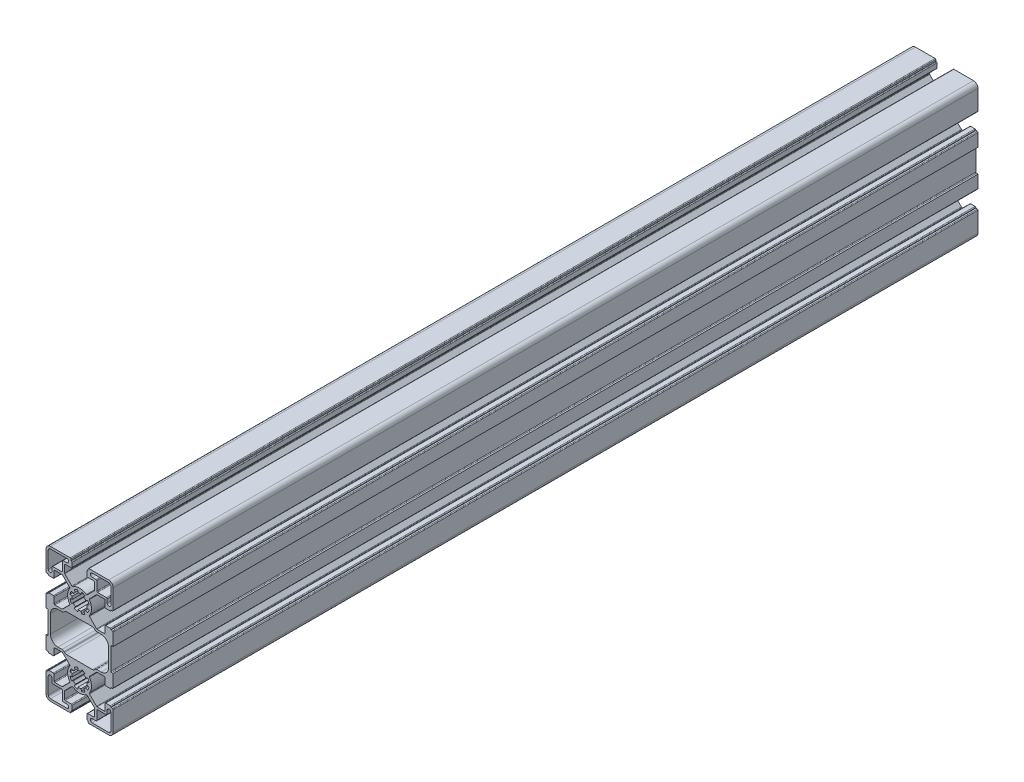
from build123d import *

# Parameters (mm, degrees)
SKETCH3_R            = 5
BOSS_EXTRUDE1_DEPTH  = 152.4
FILLET1_R            = 0.5
CUT_EXTRUDE1_DEPTH   = 309.92440823
FILLET1_OF_MIRROR1_R = 0.5
BOSS_EXTRUDE2_DEPTH  = 275.1


with BuildPart() as part:
    # Sketch3 → Boss-Extrude1 (new, symmetric)
    with BuildSketch(Plane.XY):
        with BuildLine():
            Line((-5.8, 45), (-5.8, 43.5))
            Line((-5.8, 43.5), (-5, 43.5))
            Line((-5, 43.5), (-5, 39.525))
            Line((-5, 39.525), (-10.05, 39.525))
            Line((-10.05, 39.525), (-10.05, 34.05))
            Line((-10.05, 34.05), (-4.856915373, 28.856915373))
            ThreePointArc((-4.856915373, 28.856915373), (0, 30.5), (4.856915373, 28.856915373))
            Line((4.856915373, 28.856915373), (10.05, 34.05))
            Line((10.05, 34.05), (10.05, 39.525))
            Line((10.05, 39.525), (5, 39.525))
            Line((5, 39.525), (5, 43.5))
            Line((5, 43.5), (5.8, 43.5))
            Line((5.8, 43.5), (5.8, 45))
            Line((5.8, 45), (19.5, 45))
            ThreePointArc((19.5, 45), (21.621320344, 44.121320344), (22.5, 42))
            Line((22.5, 42), (22.5, 28.3))
            Line((22.5, 28.3), (21, 28.3))
            Line((21, 28.3), (21, 27.5))
            Line((21, 27.5), (17.025, 27.5))
            Line((17.025, 27.5), (17.025, 32.55))
            Line((17.025, 32.55), (11.55, 32.55))
            Line((11.55, 32.55), (6.356915373, 27.356915373))
            ThreePointArc((6.356915373, 27.356915373), (8, 22.5), (6.356915373, 17.643084627))
            Line((6.356915373, 17.643084627), (11.55, 12.45))
            Line((11.55, 12.45), (17.025, 12.45))
            Line((17.025, 12.45), (17.025, 17.5))
            Line((17.025, 17.5), (21, 17.5))
            Line((21, 17.5), (21, 16.7))
            Line((21, 16.7), (22.5, 16.7))
            Line((22.5, 16.7), (22.5, 7.8))
            Line((22.5, 7.8), (21, 7.8))
            Line((21, 7.8), (21, 0))
            Line((21, 0), (19.5, 0))
            Line((19.5, 0), (19.5, 5.95))
            ThreePointArc((19.5, 5.95), (18.035533906, 9.485533906), (14.5, 10.95))
            Line((14.5, 10.95), (11.757106781, 10.95))
            ThreePointArc((11.757106781, 10.95), (10.991739916, 11.102240935), (10.342893219, 11.535786438))
            Line((10.342893219, 11.535786438), (10.014466094, 11.864213562))
            ThreePointArc((10.014466094, 11.864213562), (9.365619396, 12.297759065), (8.600252532, 12.45))
            Line((8.600252532, 12.45), (-8.600252532, 12.45))
            ThreePointArc((-8.600252532, 12.45), (-9.365619396, 12.297759065), (-10.014466094, 11.864213562))
            Line((-10.014466094, 11.864213562), (-10.342893219, 11.535786438))
            ThreePointArc((-10.342893219, 11.535786438), (-10.991739916, 11.102240935), (-11.757106781, 10.95))
            Line((-11.757106781, 10.95), (-14.5, 10.95))
            ThreePointArc((-14.5, 10.95), (-18.035533906, 9.485533906), (-19.5, 5.95))
            Line((-19.5, 5.95), (-19.5, 0))
            Line((-19.5, 0), (-21, 0))
            Line((-21, 0), (-21, 7.8))
            Line((-21, 7.8), (-22.5, 7.8))
            Line((-22.5, 7.8), (-22.5, 16.7))
            Line((-22.5, 16.7), (-21, 16.7))
            Line((-21, 16.7), (-21, 17.5))
            Line((-21, 17.5), (-17.025, 17.5))
            Line((-17.025, 17.5), (-17.025, 12.45))
            Line((-17.025, 12.45), (-11.55, 12.45))
            Line((-11.55, 12.45), (-6.356915373, 17.643084627))
            ThreePointArc((-6.356915373, 17.643084627), (-8, 22.5), (-6.356915373, 27.356915373))
            Line((-6.356915373, 27.356915373), (-11.55, 32.55))
            Line((-11.55, 32.55), (-17.025, 32.55))
            Line((-17.025, 32.55), (-17.025, 27.5))
            Line((-17.025, 27.5), (-21, 27.5))
            Line((-21, 27.5), (-21, 28.3))
            Line((-21, 28.3), (-22.5, 28.3))
            Line((-22.5, 28.3), (-22.5, 42))
            ThreePointArc((-22.5, 42), (-21.621320344, 44.121320344), (-19.5, 45))
            Line((-19.5, 45), (-5.8, 45))
        make_face()
        with Locations(Location((0, 22.5, 0), (0, 0, 180))):
            Circle(SKETCH3_R, mode=Mode.SUBTRACT)
        with BuildLine():
            Line((-21, 31.0375), (-21, 42))
            ThreePointArc((-21, 42), (-20.560660172, 43.060660172), (-19.5, 43.5))
            Line((-19.5, 43.5), (-8.5375, 43.5))
            ThreePointArc((-8.5375, 43.5), (-7.3, 42.2625), (-8.5375, 41.025))
            Line((-8.5375, 41.025), (-11.55, 41.025))
            Line((-11.55, 41.025), (-11.55, 34.05))
            Line((-11.55, 34.05), (-18.525, 34.05))
            Line((-18.525, 34.05), (-18.525, 31.0375))
            ThreePointArc((-18.525, 31.0375), (-19.7625, 29.8), (-21, 31.0375))
        make_face(mode=Mode.SUBTRACT)
        with BuildLine():
            Line((8.5375, 43.5), (19.5, 43.5))
            ThreePointArc((19.5, 43.5), (20.560660172, 43.060660172), (21, 42))
            Line((21, 42), (21, 31.0375))
            ThreePointArc((21, 31.0375), (19.7625, 29.8), (18.525, 31.0375))
            Line((18.525, 31.0375), (18.525, 34.05))
            Line((18.525, 34.05), (11.55, 34.05))
            Line((11.55, 34.05), (11.55, 41.025))
            Line((11.55, 41.025), (8.5375, 41.025))
            ThreePointArc((8.5375, 41.025), (7.3, 42.2625), (8.5375, 43.5))
        make_face(mode=Mode.SUBTRACT)
    boss_extrude1 = extrude(amount=BOSS_EXTRUDE1_DEPTH, both=True)

    # Fillet1
    fillet1_edges = [part.edges().sort_by_distance(p)[0] for p in [
        (-21, 7.8, 0),
        (-22.5, 16.7, 0),
        (-21, 17.5, 0),
        (-17.025, 17.5, 0),
        (-17.025, 12.45, 0),
        (-11.55, 12.45, 0),
        (-6.356915373, 17.643084627, 0),
        (-6.356915373, 27.356915373, 0),
        (-11.55, 32.55, 0),
        (-17.025, 32.55, 0),
        (-17.025, 27.5, 0),
        (-21, 27.5, 0),
        (-22.5, 28.3, 0),
        (-5.8, 45, 0),
        (-5, 43.5, 0),
        (-5, 39.525, 0),
        (-10.05, 39.525, 0),
        (-10.05, 34.05, 0),
        (-4.856915373, 28.856915373, 0),
        (4.856915373, 28.856915373, 0),
        (10.05, 34.05, 0),
        (10.05, 39.525, 0),
        (5, 39.525, 0),
        (5, 43.5, 0),
        (5.8, 45, 0),
        (22.5, 28.3, 0),
        (21, 27.5, 0),
        (17.025, 27.5, 0),
        (11.55, 32.55, 0),
        (6.356915373, 27.356915373, 0),
        (6.356915373, 17.643084627, 0),
        (11.55, 12.45, 0),
        (17.025, 12.45, 0),
        (17.025, 17.5, 0),
        (21, 17.5, 0),
        (22.5, 16.7, 0),
        (21, 7.8, 0),
        (-18.525, 34.05, 0),
        (-11.55, 34.05, 0),
        (-11.55, 41.025, 0),
        (11.55, 41.025, 0),
        (11.55, 34.05, 0),
        (18.525, 34.05, 0),
    ]]
    fillet(fillet1_edges, radius=FILLET1_R)

    # Sketch4 → Cut-Extrude1 (cut, through all)
    with BuildSketch(Plane.XY.offset(152.4)):
        with BuildLine():
            Line((-1.268087093, 28.875104323), (-0.97545161, 27.403926402))
            ThreePointArc((-0.97545161, 27.403926402), (-1.913417162, 27.119397663), (-2.777851165, 26.657348062))
            Line((-2.777851165, 26.657348062), (-3.611206515, 27.90455248))
            ThreePointArc((-3.611206515, 27.90455248), (-2.48744231, 28.505216961), (-1.268087093, 28.875104323))
        make_face()
        with BuildLine():
            Line((1.268087093, 28.875104323), (0.97545161, 27.403926402))
            ThreePointArc((0.97545161, 27.403926402), (1.913417162, 27.119397663), (2.777851165, 26.657348062))
            Line((2.777851165, 26.657348062), (3.611206515, 27.90455248))
            ThreePointArc((3.611206515, 27.90455248), (2.48744231, 28.505216961), (1.268087093, 28.875104323))
        make_face()
        with BuildLine():
            Line((5.40455248, 26.111206515), (4.157348062, 25.277851165))
            ThreePointArc((4.157348062, 25.277851165), (4.619397663, 24.413417162), (4.903926402, 23.47545161))
            Line((4.903926402, 23.47545161), (6.375104323, 23.768087093))
            ThreePointArc((6.375104323, 23.768087093), (6.005216961, 24.98744231), (5.40455248, 26.111206515))
        make_face()
        with BuildLine():
            Line((6.375104323, 21.231912907), (4.903926402, 21.52454839))
            ThreePointArc((4.903926402, 21.52454839), (4.619397663, 20.586582838), (4.157348062, 19.722148835))
            Line((4.157348062, 19.722148835), (5.40455248, 18.888793485))
            ThreePointArc((5.40455248, 18.888793485), (6.005216961, 20.01255769), (6.375104323, 21.231912907))
        make_face()
        with BuildLine():
            Line((3.611206515, 17.09544752), (2.777851165, 18.342651938))
            ThreePointArc((2.777851165, 18.342651938), (1.913417162, 17.880602337), (0.97545161, 17.596073598))
            Line((0.97545161, 17.596073598), (1.268087093, 16.124895677))
            ThreePointArc((1.268087093, 16.124895677), (2.48744231, 16.494783039), (3.611206515, 17.09544752))
        make_face()
        with BuildLine():
            Line((-1.268087093, 16.124895677), (-0.97545161, 17.596073598))
            ThreePointArc((-0.97545161, 17.596073598), (-1.913417162, 17.880602337), (-2.777851165, 18.342651938))
            Line((-2.777851165, 18.342651938), (-3.611206515, 17.09544752))
            ThreePointArc((-3.611206515, 17.09544752), (-2.48744231, 16.494783039), (-1.268087093, 16.124895677))
        make_face()
        with BuildLine():
            Line((-5.40455248, 18.888793485), (-4.157348062, 19.722148835))
            ThreePointArc((-4.157348062, 19.722148835), (-4.619397663, 20.586582838), (-4.903926402, 21.52454839))
            Line((-4.903926402, 21.52454839), (-6.375104323, 21.231912907))
            ThreePointArc((-6.375104323, 21.231912907), (-6.005216961, 20.01255769), (-5.40455248, 18.888793485))
        make_face()
        with BuildLine():
            Line((-6.375104323, 23.768087093), (-4.903926402, 23.47545161))
            ThreePointArc((-4.903926402, 23.47545161), (-4.619397663, 24.413417162), (-4.157348062, 25.277851165))
            Line((-4.157348062, 25.277851165), (-5.40455248, 26.111206515))
            ThreePointArc((-5.40455248, 26.111206515), (-6.005216961, 24.98744231), (-6.375104323, 23.768087093))
        make_face()
    cut_extrude1 = extrude(amount=-CUT_EXTRUDE1_DEPTH, mode=Mode.SUBTRACT)

    # Mirror1: Boss-Extrude1, Cut-Extrude1 across plane
    add(boss_extrude1.mirror(Plane.ZX))
    add(cut_extrude1.mirror(Plane.ZX), mode=Mode.SUBTRACT)

    # Fillet1 of Mirror1
    fillet1_of_mirror1_edges = [part.edges().sort_by_distance(p)[0] for p in [
        (-21, -7.8, 0),
        (-22.5, -16.7, 0),
        (-21, -17.5, 0),
        (-17.025, -17.5, 0),
        (-17.025, -12.45, 0),
        (-11.55, -12.45, 0),
        (-6.356915373, -17.643084627, 0),
        (-6.356915373, -27.356915373, 0),
        (-11.55, -32.55, 0),
        (-17.025, -32.55, 0),
        (-17.025, -27.5, 0),
        (-21, -27.5, 0),
        (-22.5, -28.3, 0),
        (-5.8, -45, 0),
        (-5, -43.5, 0),
        (-5, -39.525, 0),
        (-10.05, -39.525, 0),
        (-10.05, -34.05, 0),
        (-4.856915373, -28.856915373, 0),
        (4.856915373, -28.856915373, 0),
        (10.05, -34.05, 0),
        (10.05, -39.525, 0),
        (5, -39.525, 0),
        (5, -43.5, 0),
        (5.8, -45, 0),
        (22.5, -28.3, 0),
        (21, -27.5, 0),
        (17.025, -27.5, 0),
        (11.55, -32.55, 0),
        (6.356915373, -27.356915373, 0),
        (6.356915373, -17.643084627, 0),
        (11.55, -12.45, 0),
        (17.025, -12.45, 0),
        (17.025, -17.5, 0),
        (21, -17.5, 0),
        (22.5, -16.7, 0),
        (21, -7.8, 0),
        (-18.525, -34.05, 0),
        (-11.55, -34.05, 0),
        (-11.55, -41.025, 0),
        (11.55, -41.025, 0),
        (11.55, -34.05, 0),
        (18.525, -34.05, 0),
    ]]
    fillet(fillet1_of_mirror1_edges, radius=FILLET1_OF_MIRROR1_R)

    # Sketch5 → Boss-Extrude2 (add)
    with BuildSketch(Plane.XY.offset(152.4)):
        with BuildLine():
            Line((21, -16.7), (22, -16.7))
            ThreePointArc((22, -16.7), (22.353553391, -16.553553391), (22.5, -16.2))
            Line((22.5, -16.2), (22.5, -7.8))
            Line((22.5, -7.8), (21.5, -7.8))
            ThreePointArc((21.5, -7.8), (21.146446609, -7.653553391), (21, -7.3))
            Line((21, -7.3), (21, 7.3))
            ThreePointArc((21, 7.3), (21.146446609, 7.653553391), (21.5, 7.8))
            Line((21.5, 7.8), (22.5, 7.8))
            Line((22.5, 7.8), (22.5, 16.2))
            ThreePointArc((22.5, 16.2), (22.353553391, 16.553553391), (22, 16.7))
            Line((22, 16.7), (21, 16.7))
            Line((21, 16.7), (21, 17))
            ThreePointArc((21, 17), (20.853553391, 17.353553391), (20.5, 17.5))
            Line((20.5, 17.5), (17.525, 17.5))
            ThreePointArc((17.525, 17.5), (17.171446609, 17.353553391), (17.025, 17))
            Line((17.025, 17), (17.025, 12.95))
            ThreePointArc((17.025, 12.95), (16.878553391, 12.596446609), (16.525, 12.45))
            Line((16.525, 12.45), (11.757106781, 12.45))
            ThreePointArc((11.757106781, 12.45), (11.565765065, 12.488060234), (11.403553391, 12.596446609))
            Line((11.403553391, 12.596446609), (6.658229, 17.341771))
            ThreePointArc((6.658229, 17.341771), (6.513911961, 17.649226283), (6.599324603, 17.977952368))
            ThreePointArc((6.599324603, 17.977952368), (8, 22.5), (6.599324603, 27.022047632))
            ThreePointArc((6.599324603, 27.022047632), (6.513911961, 27.350773717), (6.658229, 27.658229))
            Line((6.658229, 27.658229), (11.403553391, 32.403553391))
            ThreePointArc((11.403553391, 32.403553391), (11.565765065, 32.511939766), (11.757106781, 32.55))
            Line((11.757106781, 32.55), (17.025, 32.55))
            Line((17.025, 32.55), (17.025, 28))
            ThreePointArc((17.025, 28), (17.171446609, 27.646446609), (17.525, 27.5))
            Line((17.525, 27.5), (20.5, 27.5))
            ThreePointArc((20.5, 27.5), (20.853553391, 27.646446609), (21, 28))
            Line((21, 28), (21, 28.3))
            Line((21, 28.3), (22, 28.3))
            ThreePointArc((22, 28.3), (22.353553391, 28.446446609), (22.5, 28.8))
            Line((22.5, 28.8), (22.5, 42))
            ThreePointArc((22.5, 42), (21.621320344, 44.121320344), (19.5, 45))
            Line((19.5, 45), (6.3, 45))
            ThreePointArc((6.3, 45), (5.946446609, 44.853553391), (5.8, 44.5))
            Line((5.8, 44.5), (5.8, 43.5))
            Line((5.8, 43.5), (5.5, 43.5))
            ThreePointArc((5.5, 43.5), (5.146446609, 43.353553391), (5, 43))
            Line((5, 43), (5, 40.025))
            ThreePointArc((5, 40.025), (5.146446609, 39.671446609), (5.5, 39.525))
            Line((5.5, 39.525), (9.55, 39.525))
            ThreePointArc((9.55, 39.525), (9.903553391, 39.378553391), (10.05, 39.025))
            Line((10.05, 39.025), (10.05, 34.257106781))
            ThreePointArc((10.05, 34.257106781), (10.011939766, 34.065765065), (9.903553391, 33.903553391))
            Line((9.903553391, 33.903553391), (5.158229, 29.158229))
            ThreePointArc((5.158229, 29.158229), (4.850773717, 29.013911961), (4.522047632, 29.099324603))
            ThreePointArc((4.522047632, 29.099324603), (0, 30.5), (-4.522047632, 29.099324603))
            ThreePointArc((-4.522047632, 29.099324603), (-4.850773717, 29.013911961), (-5.158229, 29.158229))
            Line((-5.158229, 29.158229), (-9.903553391, 33.903553391))
            ThreePointArc((-9.903553391, 33.903553391), (-10.011939766, 34.065765065), (-10.05, 34.257106781))
            Line((-10.05, 34.257106781), (-10.05, 39.025))
            ThreePointArc((-10.05, 39.025), (-9.903553391, 39.378553391), (-9.55, 39.525))
            Line((-9.55, 39.525), (-5.5, 39.525))
            ThreePointArc((-5.5, 39.525), (-5.146446609, 39.671446609), (-5, 40.025))
            Line((-5, 40.025), (-5, 43))
            ThreePointArc((-5, 43), (-5.146446609, 43.353553391), (-5.5, 43.5))
            Line((-5.5, 43.5), (-5.8, 43.5))
            Line((-5.8, 43.5), (-5.8, 44.5))
            ThreePointArc((-5.8, 44.5), (-5.946446609, 44.853553391), (-6.3, 45))
            Line((-6.3, 45), (-19.5, 45))
            ThreePointArc((-19.5, 45), (-21.621320344, 44.121320344), (-22.5, 42))
            Line((-22.5, 42), (-22.5, 28.8))
            ThreePointArc((-22.5, 28.8), (-22.353553391, 28.446446609), (-22, 28.3))
            Line((-22, 28.3), (-21, 28.3))
            Line((-21, 28.3), (-21, 28))
            ThreePointArc((-21, 28), (-20.853553391, 27.646446609), (-20.5, 27.5))
            Line((-20.5, 27.5), (-17.525, 27.5))
            ThreePointArc((-17.525, 27.5), (-17.171446609, 27.646446609), (-17.025, 28))
            Line((-17.025, 28), (-17.025, 32.05))
            ThreePointArc((-17.025, 32.05), (-16.878553391, 32.403553391), (-16.525, 32.55))
            Line((-16.525, 32.55), (-11.757106781, 32.55))
            ThreePointArc((-11.757106781, 32.55), (-11.565765065, 32.511939766), (-11.403553391, 32.403553391))
            Line((-11.403553391, 32.403553391), (-6.658229, 27.658229))
            ThreePointArc((-6.658229, 27.658229), (-6.513911961, 27.350773717), (-6.599324603, 27.022047632))
            ThreePointArc((-6.599324603, 27.022047632), (-8, 22.5), (-6.599324603, 17.977952368))
            ThreePointArc((-6.599324603, 17.977952368), (-6.513911961, 17.649226283), (-6.658229, 17.341771))
            Line((-6.658229, 17.341771), (-11.403553391, 12.596446609))
            ThreePointArc((-11.403553391, 12.596446609), (-11.565765065, 12.488060234), (-11.757106781, 12.45))
            Line((-11.757106781, 12.45), (-16.525, 12.45))
            ThreePointArc((-16.525, 12.45), (-16.878553391, 12.596446609), (-17.025, 12.95))
            Line((-17.025, 12.95), (-17.025, 17))
            ThreePointArc((-17.025, 17), (-17.171446609, 17.353553391), (-17.525, 17.5))
            Line((-17.525, 17.5), (-20.5, 17.5))
            ThreePointArc((-20.5, 17.5), (-20.853553391, 17.353553391), (-21, 17))
            Line((-21, 17), (-21, 16.7))
            Line((-21, 16.7), (-22, 16.7))
            ThreePointArc((-22, 16.7), (-22.353553391, 16.553553391), (-22.5, 16.2))
            Line((-22.5, 16.2), (-22.5, 7.8))
            Line((-22.5, 7.8), (-21.5, 7.8))
            ThreePointArc((-21.5, 7.8), (-21.146446609, 7.653553391), (-21, 7.3))
            Line((-21, 7.3), (-21, -7.3))
            ThreePointArc((-21, -7.3), (-21.146446609, -7.653553391), (-21.5, -7.8))
            Line((-21.5, -7.8), (-22.5, -7.8))
            Line((-22.5, -7.8), (-22.5, -16.2))
            ThreePointArc((-22.5, -16.2), (-22.353553391, -16.553553391), (-22, -16.7))
            Line((-22, -16.7), (-21, -16.7))
            Line((-21, -16.7), (-21, -17))
            ThreePointArc((-21, -17), (-20.853553391, -17.353553391), (-20.5, -17.5))
            Line((-20.5, -17.5), (-17.525, -17.5))
            ThreePointArc((-17.525, -17.5), (-17.171446609, -17.353553391), (-17.025, -17))
            Line((-17.025, -17), (-17.025, -12.95))
            ThreePointArc((-17.025, -12.95), (-16.878553391, -12.596446609), (-16.525, -12.45))
            Line((-16.525, -12.45), (-11.757106781, -12.45))
            ThreePointArc((-11.757106781, -12.45), (-11.565765065, -12.488060234), (-11.403553391, -12.596446609))
            Line((-11.403553391, -12.596446609), (-6.658229, -17.341771))
            ThreePointArc((-6.658229, -17.341771), (-6.513911961, -17.649226283), (-6.599324603, -17.977952368))
            ThreePointArc((-6.599324603, -17.977952368), (-8, -22.5), (-6.599324603, -27.022047632))
            ThreePointArc((-6.599324603, -27.022047632), (-6.513911961, -27.350773717), (-6.658229, -27.658229))
            Line((-6.658229, -27.658229), (-11.403553391, -32.403553391))
            ThreePointArc((-11.403553391, -32.403553391), (-11.565765065, -32.511939766), (-11.757106781, -32.55))
            Line((-11.757106781, -32.55), (-16.525, -32.55))
            ThreePointArc((-16.525, -32.55), (-16.878553391, -32.403553391), (-17.025, -32.05))
            Line((-17.025, -32.05), (-17.025, -28))
            ThreePointArc((-17.025, -28), (-17.171446609, -27.646446609), (-17.525, -27.5))
            Line((-17.525, -27.5), (-20.5, -27.5))
            ThreePointArc((-20.5, -27.5), (-20.853553391, -27.646446609), (-21, -28))
            Line((-21, -28), (-21, -28.3))
            Line((-21, -28.3), (-22, -28.3))
            ThreePointArc((-22, -28.3), (-22.353553391, -28.446446609), (-22.5, -28.8))
            Line((-22.5, -28.8), (-22.5, -42))
            ThreePointArc((-22.5, -42), (-21.621320344, -44.121320344), (-19.5, -45))
            Line((-19.5, -45), (-6.3, -45))
            ThreePointArc((-6.3, -45), (-5.946446609, -44.853553391), (-5.8, -44.5))
            Line((-5.8, -44.5), (-5.8, -43.5))
            Line((-5.8, -43.5), (-5.5, -43.5))
            ThreePointArc((-5.5, -43.5), (-5.146446609, -43.353553391), (-5, -43))
            Line((-5, -43), (-5, -40.025))
            ThreePointArc((-5, -40.025), (-5.146446609, -39.671446609), (-5.5, -39.525))
            Line((-5.5, -39.525), (-9.55, -39.525))
            ThreePointArc((-9.55, -39.525), (-9.903553391, -39.378553391), (-10.05, -39.025))
            Line((-10.05, -39.025), (-10.05, -34.257106781))
            ThreePointArc((-10.05, -34.257106781), (-10.011939766, -34.065765065), (-9.903553391, -33.903553391))
            Line((-9.903553391, -33.903553391), (-5.158229, -29.158229))
            ThreePointArc((-5.158229, -29.158229), (-4.850773717, -29.013911961), (-4.522047632, -29.099324603))
            ThreePointArc((-4.522047632, -29.099324603), (0, -30.5), (4.522047632, -29.099324603))
            ThreePointArc((4.522047632, -29.099324603), (4.850773717, -29.013911961), (5.158229, -29.158229))
            Line((5.158229, -29.158229), (9.903553391, -33.903553391))
            ThreePointArc((9.903553391, -33.903553391), (10.011939766, -34.065765065), (10.05, -34.257106781))
            Line((10.05, -34.257106781), (10.05, -39.025))
            ThreePointArc((10.05, -39.025), (9.903553391, -39.378553391), (9.55, -39.525))
            Line((9.55, -39.525), (5.5, -39.525))
            ThreePointArc((5.5, -39.525), (5.146446609, -39.671446609), (5, -40.025))
            Line((5, -40.025), (5, -43))
            ThreePointArc((5, -43), (5.146446609, -43.353553391), (5.5, -43.5))
            Line((5.5, -43.5), (5.8, -43.5))
            Line((5.8, -43.5), (5.8, -44.5))
            ThreePointArc((5.8, -44.5), (5.946446609, -44.853553391), (6.3, -45))
            Line((6.3, -45), (19.5, -45))
            ThreePointArc((19.5, -45), (21.621320344, -44.121320344), (22.5, -42))
            Line((22.5, -42), (22.5, -28.8))
            ThreePointArc((22.5, -28.8), (22.353553391, -28.446446609), (22, -28.3))
            Line((22, -28.3), (21, -28.3))
            Line((21, -28.3), (21, -28))
            ThreePointArc((21, -28), (20.853553391, -27.646446609), (20.5, -27.5))
            Line((20.5, -27.5), (17.525, -27.5))
            ThreePointArc((17.525, -27.5), (17.171446609, -27.646446609), (17.025, -28))
            Line((17.025, -28), (17.025, -32.55))
            Line((17.025, -32.55), (11.757106781, -32.55))
            ThreePointArc((11.757106781, -32.55), (11.565765065, -32.511939766), (11.403553391, -32.403553391))
            Line((11.403553391, -32.403553391), (6.658229, -27.658229))
            ThreePointArc((6.658229, -27.658229), (6.513911961, -27.350773717), (6.599324603, -27.022047632))
            ThreePointArc((6.599324603, -27.022047632), (8, -22.5), (6.599324603, -17.977952368))
            ThreePointArc((6.599324603, -17.977952368), (6.513911961, -17.649226283), (6.658229, -17.341771))
            Line((6.658229, -17.341771), (11.403553391, -12.596446609))
            ThreePointArc((11.403553391, -12.596446609), (11.565765065, -12.488060234), (11.757106781, -12.45))
            Line((11.757106781, -12.45), (16.525, -12.45))
            ThreePointArc((16.525, -12.45), (16.878553391, -12.596446609), (17.025, -12.95))
            Line((17.025, -12.95), (17.025, -17))
            ThreePointArc((17.025, -17), (17.171446609, -17.353553391), (17.525, -17.5))
            Line((17.525, -17.5), (20.5, -17.5))
            ThreePointArc((20.5, -17.5), (20.853553391, -17.353553391), (21, -17))
            Line((21, -17), (21, -16.7))
        make_face()
        with BuildLine():
            Line((-18.525, -33.55), (-18.525, -31.0375))
            ThreePointArc((-18.525, -31.0375), (-19.7625, -29.8), (-21, -31.0375))
            Line((-21, -31.0375), (-21, -42))
            ThreePointArc((-21, -42), (-20.560660172, -43.060660172), (-19.5, -43.5))
            Line((-19.5, -43.5), (-8.5375, -43.5))
            ThreePointArc((-8.5375, -43.5), (-7.3, -42.2625), (-8.5375, -41.025))
            Line((-8.5375, -41.025), (-11.05, -41.025))
            ThreePointArc((-11.05, -41.025), (-11.403553391, -40.878553391), (-11.55, -40.525))
            Line((-11.55, -40.525), (-11.55, -34.55))
            ThreePointArc((-11.55, -34.55), (-11.696446609, -34.196446609), (-12.05, -34.05))
            Line((-12.05, -34.05), (-18.025, -34.05))
            ThreePointArc((-18.025, -34.05), (-18.378553391, -33.903553391), (-18.525, -33.55))
        make_face(mode=Mode.SUBTRACT)
        with BuildLine():
            Line((11.05, -41.025), (8.5375, -41.025))
            ThreePointArc((8.5375, -41.025), (7.3, -42.2625), (8.5375, -43.5))
            Line((8.5375, -43.5), (19.5, -43.5))
            ThreePointArc((19.5, -43.5), (20.560660172, -43.060660172), (21, -42))
            Line((21, -42), (21, -31.0375))
            ThreePointArc((21, -31.0375), (19.7625, -29.8), (18.525, -31.0375))
            Line((18.525, -31.0375), (18.525, -33.55))
            ThreePointArc((18.525, -33.55), (18.378553391, -33.903553391), (18.025, -34.05))
            Line((18.025, -34.05), (12.05, -34.05))
            ThreePointArc((12.05, -34.05), (11.696446609, -34.196446609), (11.55, -34.55))
            Line((11.55, -34.55), (11.55, -40.525))
            ThreePointArc((11.55, -40.525), (11.403553391, -40.878553391), (11.05, -41.025))
        make_face(mode=Mode.SUBTRACT)
        with BuildLine():
            Line((-2.777851165, -26.657348062), (-3.611206515, -27.90455248))
            ThreePointArc((-3.611206515, -27.90455248), (-2.48744231, -28.505216961), (-1.268087093, -28.875104323))
            Line((-1.268087093, -28.875104323), (-0.97545161, -27.403926402))
            ThreePointArc((-0.97545161, -27.403926402), (0, -27.5), (0.97545161, -27.403926402))
            Line((0.97545161, -27.403926402), (1.268087093, -28.875104323))
            ThreePointArc((1.268087093, -28.875104323), (2.48744231, -28.505216961), (3.611206515, -27.90455248))
            Line((3.611206515, -27.90455248), (2.777851165, -26.657348062))
            ThreePointArc((2.777851165, -26.657348062), (3.535533906, -26.035533906), (4.157348062, -25.277851165))
            Line((4.157348062, -25.277851165), (5.40455248, -26.111206515))
            ThreePointArc((5.40455248, -26.111206515), (6.005216961, -24.98744231), (6.375104323, -23.768087093))
            Line((6.375104323, -23.768087093), (4.903926402, -23.47545161))
            ThreePointArc((4.903926402, -23.47545161), (5, -22.5), (4.903926402, -21.52454839))
            Line((4.903926402, -21.52454839), (6.375104323, -21.231912907))
            ThreePointArc((6.375104323, -21.231912907), (6.005216961, -20.01255769), (5.40455248, -18.888793485))
            Line((5.40455248, -18.888793485), (4.157348062, -19.722148835))
            ThreePointArc((4.157348062, -19.722148835), (3.535533906, -18.964466094), (2.777851165, -18.342651938))
            Line((2.777851165, -18.342651938), (3.611206515, -17.09544752))
            ThreePointArc((3.611206515, -17.09544752), (2.48744231, -16.494783039), (1.268087093, -16.124895677))
            Line((1.268087093, -16.124895677), (0.97545161, -17.596073598))
            ThreePointArc((0.97545161, -17.596073598), (0, -17.5), (-0.97545161, -17.596073598))
            Line((-0.97545161, -17.596073598), (-1.268087093, -16.124895677))
            ThreePointArc((-1.268087093, -16.124895677), (-2.48744231, -16.494783039), (-3.611206515, -17.09544752))
            Line((-3.611206515, -17.09544752), (-2.777851165, -18.342651938))
            ThreePointArc((-2.777851165, -18.342651938), (-3.535533906, -18.964466094), (-4.157348062, -19.722148835))
            Line((-4.157348062, -19.722148835), (-5.40455248, -18.888793485))
            ThreePointArc((-5.40455248, -18.888793485), (-6.005216961, -20.01255769), (-6.375104323, -21.231912907))
            Line((-6.375104323, -21.231912907), (-4.903926402, -21.52454839))
            ThreePointArc((-4.903926402, -21.52454839), (-5, -22.5), (-4.903926402, -23.47545161))
            Line((-4.903926402, -23.47545161), (-6.375104323, -23.768087093))
            ThreePointArc((-6.375104323, -23.768087093), (-6.005216961, -24.98744231), (-5.40455248, -26.111206515))
            Line((-5.40455248, -26.111206515), (-4.157348062, -25.277851165))
            ThreePointArc((-4.157348062, -25.277851165), (-3.535533906, -26.035533906), (-2.777851165, -26.657348062))
        make_face(mode=Mode.SUBTRACT)
        with BuildLine():
            Line((-19.5, 5.95), (-19.5, -5.95))
            ThreePointArc((-19.5, -5.95), (-18.035533906, -9.485533906), (-14.5, -10.95))
            Line((-14.5, -10.95), (-11.757106781, -10.95))
            ThreePointArc((-11.757106781, -10.95), (-10.991739916, -11.102240935), (-10.342893219, -11.535786438))
            Line((-10.342893219, -11.535786438), (-10.014466094, -11.864213562))
            ThreePointArc((-10.014466094, -11.864213562), (-9.365619396, -12.297759065), (-8.600252532, -12.45))
            Line((-8.600252532, -12.45), (8.600252532, -12.45))
            ThreePointArc((8.600252532, -12.45), (9.365619396, -12.297759065), (10.014466094, -11.864213562))
            Line((10.014466094, -11.864213562), (10.342893219, -11.535786438))
            ThreePointArc((10.342893219, -11.535786438), (10.991739916, -11.102240935), (11.757106781, -10.95))
            Line((11.757106781, -10.95), (14.5, -10.95))
            ThreePointArc((14.5, -10.95), (18.035533906, -9.485533906), (19.5, -5.95))
            Line((19.5, -5.95), (19.5, 5.95))
            ThreePointArc((19.5, 5.95), (18.035533906, 9.485533906), (14.5, 10.95))
            Line((14.5, 10.95), (11.757106781, 10.95))
            ThreePointArc((11.757106781, 10.95), (10.991739916, 11.102240935), (10.342893219, 11.535786438))
            Line((10.342893219, 11.535786438), (10.014466094, 11.864213562))
            ThreePointArc((10.014466094, 11.864213562), (9.365619396, 12.297759065), (8.600252532, 12.45))
            Line((8.600252532, 12.45), (-8.600252532, 12.45))
            ThreePointArc((-8.600252532, 12.45), (-9.365619396, 12.297759065), (-10.014466094, 11.864213562))
            Line((-10.014466094, 11.864213562), (-10.342893219, 11.535786438))
            ThreePointArc((-10.342893219, 11.535786438), (-10.991739916, 11.102240935), (-11.757106781, 10.95))
            Line((-11.757106781, 10.95), (-14.5, 10.95))
            ThreePointArc((-14.5, 10.95), (-18.035533906, 9.485533906), (-19.5, 5.95))
        make_face(mode=Mode.SUBTRACT)
        with BuildLine():
            Line((11.55, 40.525), (11.55, 34.55))
            ThreePointArc((11.55, 34.55), (11.696446609, 34.196446609), (12.05, 34.05))
            Line((12.05, 34.05), (18.025, 34.05))
            ThreePointArc((18.025, 34.05), (18.378553391, 33.903553391), (18.525, 33.55))
            Line((18.525, 33.55), (18.525, 31.0375))
            ThreePointArc((18.525, 31.0375), (19.7625, 29.8), (21, 31.0375))
            Line((21, 31.0375), (21, 42))
            ThreePointArc((21, 42), (20.560660172, 43.060660172), (19.5, 43.5))
            Line((19.5, 43.5), (8.5375, 43.5))
            ThreePointArc((8.5375, 43.5), (7.3, 42.2625), (8.5375, 41.025))
            Line((8.5375, 41.025), (11.05, 41.025))
            ThreePointArc((11.05, 41.025), (11.403553391, 40.878553391), (11.55, 40.525))
        make_face(mode=Mode.SUBTRACT)
        with BuildLine():
            Line((-0.97545161, 27.403926402), (-1.268087093, 28.875104323))
            ThreePointArc((-1.268087093, 28.875104323), (-2.48744231, 28.505216961), (-3.611206515, 27.90455248))
            Line((-3.611206515, 27.90455248), (-2.777851165, 26.657348062))
            ThreePointArc((-2.777851165, 26.657348062), (-3.535533906, 26.035533906), (-4.157348062, 25.277851165))
            Line((-4.157348062, 25.277851165), (-5.40455248, 26.111206515))
            ThreePointArc((-5.40455248, 26.111206515), (-6.005216961, 24.98744231), (-6.375104323, 23.768087093))
            Line((-6.375104323, 23.768087093), (-4.903926402, 23.47545161))
            ThreePointArc((-4.903926402, 23.47545161), (-5, 22.5), (-4.903926402, 21.52454839))
            Line((-4.903926402, 21.52454839), (-6.375104323, 21.231912907))
            ThreePointArc((-6.375104323, 21.231912907), (-6.005216961, 20.01255769), (-5.40455248, 18.888793485))
            Line((-5.40455248, 18.888793485), (-4.157348062, 19.722148835))
            ThreePointArc((-4.157348062, 19.722148835), (-3.535533906, 18.964466094), (-2.777851165, 18.342651938))
            Line((-2.777851165, 18.342651938), (-3.611206515, 17.09544752))
            ThreePointArc((-3.611206515, 17.09544752), (-2.48744231, 16.494783039), (-1.268087093, 16.124895677))
            Line((-1.268087093, 16.124895677), (-0.97545161, 17.596073598))
            ThreePointArc((-0.97545161, 17.596073598), (0, 17.5), (0.97545161, 17.596073598))
            Line((0.97545161, 17.596073598), (1.268087093, 16.124895677))
            ThreePointArc((1.268087093, 16.124895677), (2.48744231, 16.494783039), (3.611206515, 17.09544752))
            Line((3.611206515, 17.09544752), (2.777851165, 18.342651938))
            ThreePointArc((2.777851165, 18.342651938), (3.535533906, 18.964466094), (4.157348062, 19.722148835))
            Line((4.157348062, 19.722148835), (5.40455248, 18.888793485))
            ThreePointArc((5.40455248, 18.888793485), (6.005216961, 20.01255769), (6.375104323, 21.231912907))
            Line((6.375104323, 21.231912907), (4.903926402, 21.52454839))
            ThreePointArc((4.903926402, 21.52454839), (5, 22.5), (4.903926402, 23.47545161))
            Line((4.903926402, 23.47545161), (6.375104323, 23.768087093))
            ThreePointArc((6.375104323, 23.768087093), (6.005216961, 24.98744231), (5.40455248, 26.111206515))
            Line((5.40455248, 26.111206515), (4.157348062, 25.277851165))
            ThreePointArc((4.157348062, 25.277851165), (3.535533906, 26.035533906), (2.777851165, 26.657348062))
            Line((2.777851165, 26.657348062), (3.611206515, 27.90455248))
            ThreePointArc((3.611206515, 27.90455248), (2.48744231, 28.505216961), (1.268087093, 28.875104323))
            Line((1.268087093, 28.875104323), (0.97545161, 27.403926402))
            ThreePointArc((0.97545161, 27.403926402), (0, 27.5), (-0.97545161, 27.403926402))
        make_face(mode=Mode.SUBTRACT)
        with BuildLine():
            Line((-18.025, 34.05), (-12.05, 34.05))
            ThreePointArc((-12.05, 34.05), (-11.696446609, 34.196446609), (-11.55, 34.55))
            Line((-11.55, 34.55), (-11.55, 40.525))
            ThreePointArc((-11.55, 40.525), (-11.403553391, 40.878553391), (-11.05, 41.025))
            Line((-11.05, 41.025), (-8.5375, 41.025))
            ThreePointArc((-8.5375, 41.025), (-7.3, 42.2625), (-8.5375, 43.5))
            Line((-8.5375, 43.5), (-19.5, 43.5))
            ThreePointArc((-19.5, 43.5), (-20.560660172, 43.060660172), (-21, 42))
            Line((-21, 42), (-21, 31.0375))
            ThreePointArc((-21, 31.0375), (-19.7625, 29.8), (-18.525, 31.0375))
            Line((-18.525, 31.0375), (-18.525, 33.55))
            ThreePointArc((-18.525, 33.55), (-18.378553391, 33.903553391), (-18.025, 34.05))
        make_face(mode=Mode.SUBTRACT)
    extrude(amount=BOSS_EXTRUDE2_DEPTH)


solid = part.part
